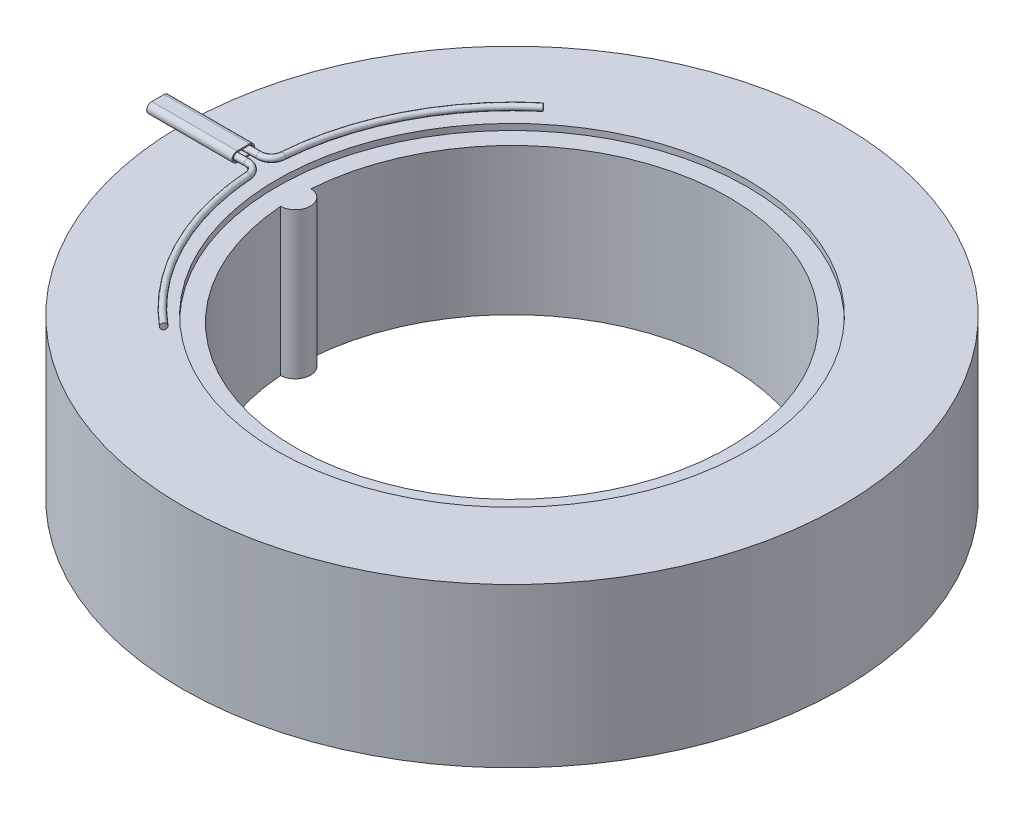
from build123d import *

# Parameters (mm, degrees)
SKETCH1_W                       = 1.5
SKETCH1_H                       = 12
SKETCH2_W                       = 7.75
SKETCH2_H                       = 13
BOSS_EXTRUDE1_REACH             = 40.733
SKETCH3_R                       = 1.25
BOSS_EXTRUDE1_DIRECTION_2_REACH = 40.733
SWEEP1_PROFILE_R                = 0.25
EXTRUDE_THIN1_START             = -22
EXTRUDE_THIN1_DEPTH             = 7


with BuildPart() as part:
    # Sketch1 → Revolve1 (revolve)
    with BuildSketch(Plane.XY):
        with Locations((-18.5, 0)):
            Rectangle(SKETCH1_W, SKETCH1_H)
    revolve(axis=Axis((0, 0, 0), (0, -1, 0)))

    # Boss-Extrude1: up to this face of the body (flat: up to its plane)
    boss_extrude1_end = Plane(part.part.faces().sort_by_distance((18.705527778, 6, 0))[0])
    # Sketch3 → Boss-Extrude1 (add, up to the picked face)
    with BuildSketch(Plane(origin=(0, 0, 0), x_dir=(1, 0, 0), z_dir=(0, 1, 0)), mode=Mode.PRIVATE) as boss_extrude1_sk1:
        with Locations((-17.75, 0)):
            Circle(SKETCH3_R)
    boss_extrude1_tool1 = split(extrude(boss_extrude1_sk1.sketch, amount=BOSS_EXTRUDE1_REACH, mode=Mode.PRIVATE), bisect_by=boss_extrude1_end, keep=Keep.BOTH, mode=Mode.PRIVATE)
    add(boss_extrude1_tool1.solids().sort_by(Axis((-17.75, 0, 0), (0, 1, 0)))[0])

    # Boss-Extrude1 direction 2: up to this face of the body (flat: up to its plane)
    boss_extrude1_direction_2_end = Plane(part.part.faces().sort_by_distance((18.294472222, -6, 0))[0])
    # Sketch3 → Boss-Extrude1 direction 2 (add, up to the picked face)
    with BuildSketch(Plane(origin=(0, 0, 0), x_dir=(1, 0, 0), z_dir=(0, 1, 0)), mode=Mode.PRIVATE) as boss_extrude1_direction_2_sk1:
        with Locations((-17.75, 0)):
            Circle(SKETCH3_R)
    boss_extrude1_direction_2_tool1 = split(extrude(boss_extrude1_direction_2_sk1.sketch, amount=-BOSS_EXTRUDE1_DIRECTION_2_REACH, mode=Mode.PRIVATE), bisect_by=boss_extrude1_direction_2_end, keep=Keep.BOTH, mode=Mode.PRIVATE)
    add(boss_extrude1_direction_2_tool1.solids().sort_by(Axis((-17.75, 0, 0), (0, -1, 0)))[0])


with BuildPart() as body_2:
    # Sketch2 → Revolve2 (revolve)
    with BuildSketch(Plane.XY):
        with Locations((-23.125, 0)):
            Rectangle(SKETCH2_W, SKETCH2_H)
    revolve(axis=Axis((0, 0, 0), (0, -1, 0)))


with BuildPart() as body_3:
    # Sweep1: sweep along a path in Sketch4
    with BuildLine(Plane(origin=(0, 7, 0), x_dir=(1, 0, 0), z_dir=(0, 1, 0))) as sweep1_path:
        Line((-25.807382336, 0.5), (-21.196992711, 0.5))
        ThreePointArc((-21.196992711, 0.5), (-20.515299318, 0.768362031), (-20.199487172, 1.429411765))
        ThreePointArc((-20.199487172, 1.429411765), (-18.029453574, 9.219615167), (-12.984102621, 15.53948452))
    # Sweep1 profile (on start of the path) → Sweep1 (sweep)
    with BuildSketch(Plane(origin=(-25.807382336, 7, -0.5), x_dir=(0, 0, 1), z_dir=(1, 0, 0))):
        Circle(SWEEP1_PROFILE_R)
    sweep(path=sweep1_path.line)


with BuildPart() as body_4:
    # Mirror2: mirrored copy
    add(body_3.part.mirror(Plane.XY))


with BuildPart() as body_5:
    # Sketch23 → Extrude-Thin1 (new body)
    with BuildSketch(Plane(origin=(0, 0, 0), x_dir=(0, 0, -1), z_dir=(1, 0, 0)).offset(EXTRUDE_THIN1_START)):
        with BuildLine():
            Line((-0.5, 7.414880724), (0.5, 7.414880724))
            ThreePointArc((0.5, 7.414880724), (0.914880724, 7), (0.5, 6.585119276))
            Line((0.5, 6.585119276), (-0.5, 6.585119276))
            ThreePointArc((-0.5, 6.585119276), (-0.914880724, 7), (-0.5, 7.414880724))
        make_face()
        with BuildLine():
            Line((-0.5, 7.314880724), (0.5, 7.314880724))
            ThreePointArc((0.5, 7.314880724), (0.814880724, 7), (0.5, 6.685119276))
            Line((0.5, 6.685119276), (-0.5, 6.685119276))
            ThreePointArc((-0.5, 6.685119276), (-0.814880724, 7), (-0.5, 7.314880724))
        make_face(mode=Mode.SUBTRACT)
    extrude(amount=-EXTRUDE_THIN1_DEPTH)


solid = Compound([part.part, body_2.part, body_3.part, body_4.part, body_5.part])
